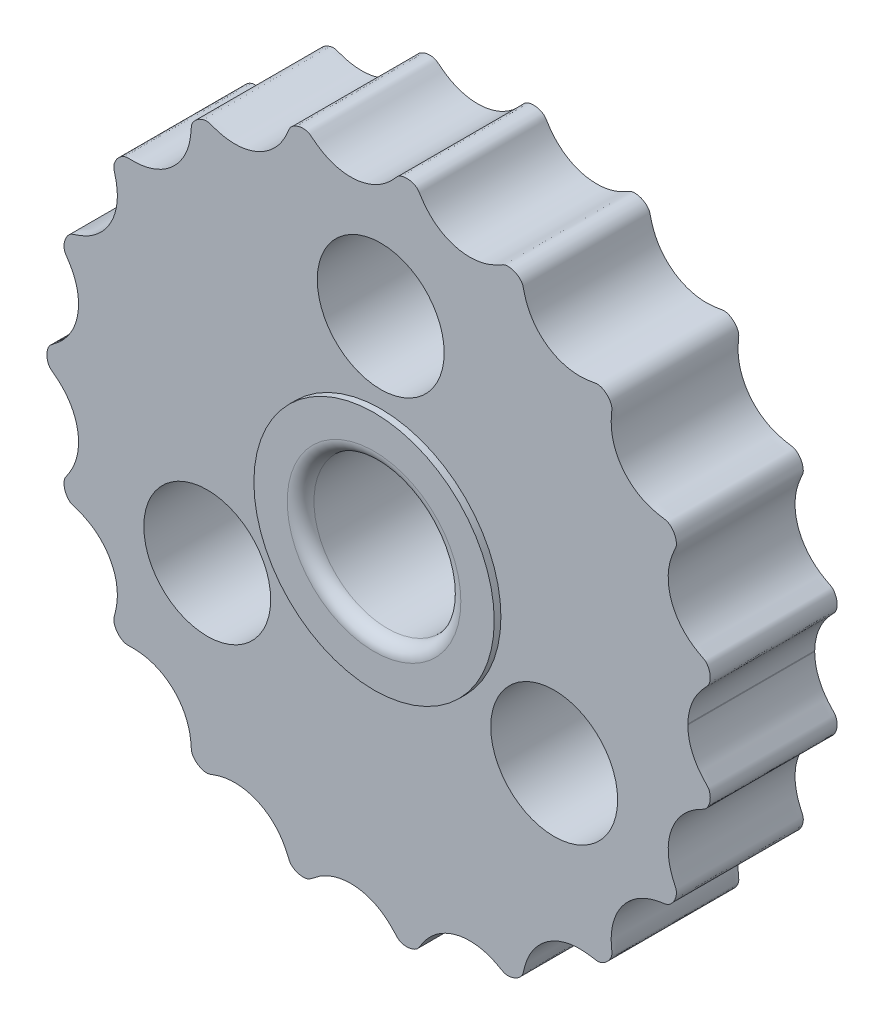
from build123d import *
from OCP.BRepAlgoAPI import BRepAlgoAPI_Cut
from OCP.TopTools import TopTools_ListOfShape

# Parameters (mm, degrees)
SKIZZE1_R                        = 25
AUFSATZ_LINEAR_AUSTRAGEN1_DEPTH  = 9.5
SCHNITT_LINEAR_AUSTRAGEN1_REACH  = 38.609
SKIZZE3_R                        = 0.5
SKIZZE9_OUTSIDE_W                = 66.268
SKIZZE9_OUTSIDE_H                = 66.263
SCHNITT_LINEAR_AUSTRAGEN6_DEPTH  = 9.5
SKIZZE23_R                       = 9
AUFSATZ_LINEAR_AUSTRAGEN2_DEPTH  = 0.5
SKIZZE21_R                       = 5.5
SCHNITT_LINEAR_AUSTRAGEN11_DEPTH = 10
VERRUNDUNG1_R                    = 1
SKIZZE22_R                       = 4.75
SCHNITT_LINEAR_AUSTRAGEN12_DEPTH = 10


with BuildPart() as part:
    # Skizze1 → Aufsatz-Linear austragen1 (new body)
    with BuildSketch(Plane.XY):
        Circle(SKIZZE1_R)
    extrude(amount=AUFSATZ_LINEAR_AUSTRAGEN1_DEPTH)

    # Skizze3 → Schnitt-Linear austragen1 (cut, up to next)
    with BuildSketch(Plane.XY.offset(9.5), mode=Mode.PRIVATE) as schnitt_linear_austragen1_sk1:
        with Locations((0, 25)):
            Circle(SKIZZE3_R)
    schnitt_linear_austragen1_tool1 = extrude(schnitt_linear_austragen1_sk1.sketch, amount=-SCHNITT_LINEAR_AUSTRAGEN1_REACH, mode=Mode.PRIVATE) & part.part
    add(schnitt_linear_austragen1_tool1.solids().sort_by_distance((0, 25, 9.5))[0], mode=Mode.SUBTRACT)


with BuildPart() as schnitt_linear_austragen6_tool:
    # Skizze9 outside → Schnitt-Linear austragen6 (new body)
    with BuildSketch(Plane.XY.offset(9.5)):
        with Locations((0, -0.0025)):
            Rectangle(SKIZZE9_OUTSIDE_W, SKIZZE9_OUTSIDE_H)
        with BuildLine():
            Line((23.000445052, 0.060937419), (23, 0))
            add(Edge.make_bspline(
                [(23, 0), (23, -0.044349008), (23.001634544, -0.133544535), (23.008990115, -0.322210424), (23.028574614, -0.495064366), (23.065190093, -0.760458288), (23.128344661, -1.048281187), (23.256601687, -1.483985708), (23.455853251, -1.931799386), (23.680914036, -2.313218321), (23.909870513, -2.622445518), (24.07431226, -2.824110253), (24.206727121, -2.972267331), (24.333633451, -3.108358174), (24.446736551, -3.225635305), (24.524022768, -3.315918282), (24.582950142, -3.415606662), (24.624575555, -3.520829648), (24.663833231, -3.668623209), (24.685212658, -3.860905388), (24.673454969, -4.086945135), (24.620520353, -4.306815249), (24.546445793, -4.484777086), (24.469451436, -4.614376883), (24.403672696, -4.702418772), (24.331050319, -4.778425537), (24.251571347, -4.839472504), (24.137679259, -4.903870311), (24.000097219, -4.973956943), (23.84602848, -5.056457749), (23.635223866, -5.176178294), (23.393295921, -5.329179221), (23.121190787, -5.527614354), (22.83161764, -5.779890288), (22.56554989, -6.056903088), (22.261697169, -6.436060568), (21.954792305, -6.933189392), (21.724897296, -7.481107687), (21.582883975, -8.065310431), (21.527316325, -8.563551076), (21.521604829, -8.970764731), (21.554125075, -9.36939933), (21.621771537, -9.756104532), (21.708688359, -10.081815143), (21.799454454, -10.348274513), (21.884205293, -10.563157843), (21.95582729, -10.729022258), (22.024783379, -10.882887471), (22.092422873, -11.024820073), (22.140398235, -11.174553681), (22.150406377, -11.346817537), (22.12742522, -11.544222174), (22.061014784, -11.76185876), (21.950504113, -11.978770955), (21.808294479, -12.167418182), (21.661405911, -12.302203337), (21.524713944, -12.391379973), (21.414032836, -12.43721046), (21.330064744, -12.458579008), (21.232109488, -12.476052218), (21.121185626, -12.492228868), (20.992061937, -12.512135255), (20.837428097, -12.539026465), (20.676348543, -12.570851463), (20.465515415, -12.619761983), (20.12052129, -12.717519847), (19.653901317, -12.897202897), (19.089906306, -13.210945732), (18.495681708, -13.693863685), (17.979768758, -14.303268377), (17.581791087, -15.018361732), (17.359944866, -15.712485613), (17.275839331, -16.272804376), (17.257885306, -16.675733613), (17.260289119, -16.912297659), (17.268312239, -17.087096877), (17.280219561, -17.249790236), (17.292103623, -17.381570247), (17.303701486, -17.494353717), (17.312264608, -17.59519884), (17.314827323, -17.684032965), (17.303731872, -17.784796247), (17.272764928, -17.89463724), (17.214331446, -18.035197831), (17.115684868, -18.199184234), (16.97055355, -18.369748736), (16.774094974, -18.530559906), (16.563256223, -18.644549245), (16.377147805, -18.704141919), (16.228010898, -18.718256331), (16.102397709, -18.706443721), (15.982650488, -18.684743591), (15.837019497, -18.658148732), (15.66401259, -18.629235343), (15.482546813, -18.604172907), (15.250492461, -18.580238466), (14.967572009, -18.565542892), (14.542882776, -18.572942029), (14.069257686, -18.636089462), (13.604258599, -18.755934349), (13.066613534, -18.966719819), (12.627823596, -19.205194372), (12.214900787, -19.503646661), (11.838876435, -19.858554155), (11.558257701, -20.183825318), (11.315746611, -20.530340865), (11.111529005, -20.892984657), (10.966201461, -21.21922683), (10.864967944, -21.499403505), (10.794070352, -21.732891274), (10.751061312, -21.893706864), (10.716991714, -22.032228461), (10.686714115, -22.158984424), (10.6596415, -22.274087772), (10.613482868, -22.409752989), (10.527338836, -22.535688011), (10.427360762, -22.644235621), (10.291112437, -22.758327008), (10.126481227, -22.862491763), (9.947040294, -22.939957105), (9.758065088, -22.988506338), (9.580990884, -23.009043361), (9.446037355, -23.007367015), (9.322218618, -22.98832781), (9.214984001, -22.94936695), (9.136712494, -22.910504045), (9.037412358, -22.855573454), (8.916331447, -22.786743456), (8.770400294, -22.708163136), (8.599394122, -22.621424072), (8.296890057, -22.482075538), (7.936423258, -22.348806181), (7.514581595, -22.240173425), (7.031331339, -22.175898472), (6.63282472, -22.160659511), (6.229783332, -22.183593355), (5.826015405, -22.24628189), (5.425311076, -22.349560047), (5.032027225, -22.494084861), (4.656518257, -22.676660873), (4.302267209, -22.894831043), (3.975506648, -23.142933834), (3.677721892, -23.416820254), (3.44405137, -23.674800098), (3.263982058, -23.904047687), (3.127014139, -24.097398487), (3.026037187, -24.249605204), (2.943370251, -24.379361317), (2.877121162, -24.486036845), (2.810740935, -24.57879713), (2.74416189, -24.652300533), (2.654279715, -24.721400662), (2.517169909, -24.800702807), (2.343070205, -24.869762739), (2.128967514, -24.917212113), (1.910391133, -24.925657676), (1.725434514, -24.904879453), (1.559739423, -24.86337266), (1.427196326, -24.812252919), (1.301753294, -24.737435115), (1.191905153, -24.625420932), (1.092920189, -24.51260355), (0.986207514, -24.3949086), (0.871449748, -24.27279856), (0.716656542, -24.117338482), (0.516618525, -23.934026062), (0.194350851, -23.67521298), (-0.281567512, -23.37339053), (-0.887269543, -23.103703015), (-1.633020944, -22.921923215), (-2.411936918, -22.880032942), (-3.183772753, -22.98328489), (-3.829023204, -23.195281934), (-4.2988972, -23.430962009), (-4.616564859, -23.630167647), (-4.823559306, -23.774552149), (-4.97774687, -23.891482046), (-5.119347714, -24.003691962), (-5.242224002, -24.103909003), (-5.336784037, -24.17043694), (-5.438268301, -24.218274505), (-5.542753751, -24.249603187), (-5.686937903, -24.275637376), (-5.871538478, -24.282233578), (-6.086374705, -24.256198966), (-6.293131419, -24.192746417), (-6.459711563, -24.112913075), (-6.600609431, -24.020448435), (-6.711181251, -23.927151216), (-6.796582984, -23.824147974), (-6.850770436, -23.71583568), (-6.898420406, -23.605777644), (-6.947365407, -23.488164192), (-7.008561783, -23.346866721), (-7.084251644, -23.183019072), (-7.185293459, -22.981995225), (-7.317773933, -22.747121988), (-7.49148797, -22.481034064), (-7.715928329, -22.192185427), (-7.968344871, -21.919017194), (-8.248406659, -21.665143187), (-8.561039816, -21.429310586), (-8.999973335, -21.15936401), (-9.485228438, -20.94396874), (-10.005750728, -20.794854161), (-10.5400902, -20.718700851), (-10.966382178, -20.701695058), (-11.385971488, -20.726307169), (-11.744136072, -20.781871828), (-12.040715619, -20.850768976), (-12.280072238, -20.919948378), (-12.464451491, -20.980432418), (-12.618960453, -21.034692841), (-12.744339362, -21.081252299), (-12.843197189, -21.112699229), (-12.914777695, -21.129342332), (-13.015493456, -21.140932804), (-13.160661859, -21.134055928), (-13.345844593, -21.094667271), (-13.56260646, -21.005188433), (-13.772683813, -20.869959052), (-13.946323804, -20.707939025), (-14.067019069, -20.543934653), (-14.143263724, -20.390738491), (-14.177226476, -20.250634214), (-14.186913508, -20.119401386), (-14.198440689, -19.946405008), (-14.213530015, -19.757442916), (-14.235675307, -19.559977047), (-14.274437993, -19.309568767), (-14.348423441, -18.950696656), (-14.498793866, -18.460238452), (-14.782089579, -17.861430032), (-15.234748365, -17.229911899), (-15.812344032, -16.679668351), (-16.491481174, -16.245685384), (-17.151171767, -15.98558094), (-17.688427228, -15.865276912), (-18.07785431, -15.818698105), (-18.344365358, -15.800803267), (-18.55154879, -15.796411929), (-18.747233389, -15.797098718), (-18.919214302, -15.801313033), (-19.042965023, -15.798032434), (-19.158541295, -15.774162573), (-19.263868768, -15.734188884), (-19.3980896, -15.664341865), (-19.552411122, -15.552423471), (-19.709792298, -15.394155651), (-19.835538635, -15.210365782), (-19.917456357, -15.039169872), (-19.969403098, -14.874816471), (-19.994190258, -14.740899926), (-19.994061908, -14.609119869), (-19.96216239, -14.459382142), (-19.920895394, -14.313172891), (-19.877538048, -14.147042514), (-19.822738803, -13.915360041), (-19.770338499, -13.638779931), (-19.729787287, -13.309541458), (-19.715499442, -12.931565797), (-19.734288413, -12.553576969), (-19.78648075, -12.177103437), (-19.872494472, -11.805088171), (-20.023495245, -11.347840311), (-20.235452427, -10.900740033), (-20.506081593, -10.477888045), (-20.831339838, -10.089797059), (-21.129561467, -9.798398433), (-21.449341767, -9.541949139), (-21.785901305, -9.320723048), (-22.090756042, -9.157591612), (-22.354079166, -9.039521408), (-22.57449546, -8.953373927), (-22.748877752, -8.891937388), (-22.912531083, -8.836937192), (-23.066356684, -8.789685219), (-23.212715882, -8.723861285), (-23.348770452, -8.613260744), (-23.480006336, -8.461017062), (-23.595931294, -8.263067795), (-23.680634411, -8.033492463), (-23.722308403, -7.802011304), (-23.721628367, -7.601527638), (-23.693635989, -7.437177019), (-23.645884227, -7.311299551), (-23.58698665, -7.21312039), (-23.50464466, -7.091898831), (-23.413480121, -6.955895234), (-23.316990468, -6.805530999), (-23.195404595, -6.600975755), (-23.068720652, -6.363313462), (-22.938312571, -6.075672915), (-22.783932861, -5.645082693), (-22.656015316, -5.100755854), (-22.599242968, -4.422068125), (-22.682573218, -3.620850866), (-22.927187084, -2.830849576), (-23.281762934, -2.183591871), (-23.6362768, -1.730779958), (-23.922117546, -1.436607135), (-24.101102734, -1.272218319), (-24.239026842, -1.154624124), (-24.371984778, -1.048237606), (-24.482308167, -0.963016223), (-24.57797062, -0.891541044), (-24.661991507, -0.827034417), (-24.732333337, -0.767244059), (-24.800898907, -0.690159367), (-24.861333187, -0.593231274), (-24.925032547, -0.457300089), (-24.978883512, -0.278375099), (-25.007975239, -0.061527264), (-24.998029137, 0.156872346), (-24.961603162, 0.339906687), (-24.906642074, 0.50012632), (-24.850441317, 0.615615614), (-24.783182463, 0.713841399), (-24.70612467, 0.790339655), (-24.641199481, 0.843342445), (-24.554870828, 0.908952697), (-24.448719227, 0.988664196), (-24.324236971, 1.08551779), (-24.183292784, 1.201125684), (-24.010485379, 1.353122041), (-23.81108179, 1.546943796), (-23.594560374, 1.787959427), (-23.371493508, 2.082915142), (-23.173407473, 2.397599431), (-23.002579424, 2.730283971), (-22.825060162, 3.168494616), (-22.696921594, 3.643219257), (-22.627743718, 4.144164769), (-22.624177416, 4.661685067), (-22.666363477, 5.09510154), (-22.751865401, 5.517351943), (-22.877747992, 5.924389933), (-23.019278499, 6.262452411), (-23.158709609, 6.535601458), (-23.284362722, 6.752410897), (-23.3882676, 6.916947859), (-23.488830891, 7.070166759), (-23.587535901, 7.210756821), (-23.671246821, 7.356766871), (-23.714168117, 7.530883328), (-23.726069468, 7.730855757), (-23.699502836, 7.95346433), (-23.630318379, 8.183104328), (-23.52633356, 8.390805115), (-23.408217078, 8.549040856), (-23.291190018, 8.662484079), (-23.187013266, 8.733895955), (-23.096821148, 8.775794948), (-22.981629081, 8.815868272), (-22.848401699, 8.858322888), (-22.69712753, 8.909663583), (-22.487141415, 8.985853442), (-22.243476665, 9.086475268), (-21.966172973, 9.220958126), (-21.659597337, 9.400507491), (-21.366019488, 9.606283221), (-21.015068462, 9.899172124), (-20.616439007, 10.319113026), (-20.277075182, 10.810519886), (-20.014381412, 11.363643533), (-19.854230856, 11.866250836), (-19.76733511, 12.278862528), (-19.722218727, 12.69227238), (-19.716907846, 13.102353212), (-19.745142047, 13.455174831), (-19.790240094, 13.74942761), (-19.839418258, 13.987801772), (-19.883928641, 14.171816656), (-19.924430221, 14.326336612), (-19.959635946, 14.452042245), (-19.981490611, 14.550865907), (-19.991146558, 14.621917303), (-19.993465617, 14.72171627), (-19.974186216, 14.864320272), (-19.919540962, 15.044506214), (-19.812527244, 15.25216623), (-19.679411984, 15.425448939), (-19.543747518, 15.55574001), (-19.401745818, 15.660735954), (-19.278658713, 15.729274103), (-19.150362589, 15.779380876), (-19.024594963, 15.798486978), (-18.926980599, 15.800538574), (-18.813257446, 15.799080978), (-18.683627696, 15.796922513), (-18.53204173, 15.796944362), (-18.31062943, 15.802325062), (-18.041284621, 15.820863743), (-17.724801817, 15.862809117), (-17.364733963, 15.94101113), (-16.917774924, 16.078626012), (-16.397352611, 16.308512891), (-15.823885698, 16.673447375), (-15.248465863, 17.213007475), (-14.783027937, 17.854203567), (-14.487819371, 18.482693114), (-14.3350991, 18.99858497), (-14.262711958, 19.375130086), (-14.226859149, 19.630575355), (-14.20749639, 19.827410906), (-14.193630668, 20.011616761), (-14.183967321, 20.173300433), (-14.169665264, 20.290528491), (-14.13620014, 20.400514429), (-14.087337219, 20.501498285), (-14.005949224, 20.629435105), (-13.880393847, 20.774171639), (-13.70771107, 20.918241132), (-13.512733191, 21.027567196), (-13.335015199, 21.093885416), (-13.164685419, 21.131095174), (-13.023217422, 21.144361796), (-12.881689292, 21.12758481), (-12.746913763, 21.081662976), (-12.631497009, 21.03976391), (-12.500061398, 20.992972587), (-12.351873906, 20.943093342), (-12.141323701, 20.87807499), (-11.86553961, 20.807502895), (-11.538863443, 20.746804727), (-11.161625373, 20.709663429), (-10.783309446, 20.705631746), (-10.303777308, 20.743163442), (-9.735365541, 20.858384867), (-9.18181952, 21.063324831), (-8.660831733, 21.356277131), (-8.259912327, 21.654194829), (-7.958145103, 21.92757187), (-7.687531539, 22.224301823), (-7.478169682, 22.501251308), (-7.318010029, 22.749249931), (-7.20056761, 22.955585939), (-7.116178939, 23.117827482), (-7.040056142, 23.277507391), (-6.979187413, 23.414280948), (-6.928975482, 23.532232778), (-6.882870247, 23.641734547), (-6.839615539, 23.742450967), (-6.773171762, 23.858311637), (-6.65282957, 23.982657264), (-6.491082256, 24.099618345), (-6.284788497, 24.198233347), (-6.048922103, 24.263470899), (-5.812488054, 24.285813995), (-5.613326656, 24.267901929), (-5.455447069, 24.226628527), (-5.347527378, 24.175192548), (-5.275554517, 24.127519588), (-5.196283273, 24.066745711), (-5.108397036, 23.995456259), (-5.005207665, 23.913288922), (-4.87956659, 23.816992501), (-4.745849829, 23.719619426), (-4.565670719, 23.597260564), (-4.257925449, 23.409520833), (-3.806481978, 23.188277614), (-3.189696877, 22.987508405), (-2.4297018, 22.881184216), (-1.632799656, 22.918771452), (-0.841139522, 23.113533128), (-0.185417958, 23.421013674), (0.279913741, 23.737791045), (0.586090336, 23.99639661), (0.75723351, 24.157626572), (0.879528328, 24.281299661), (0.990419271, 24.399613911), (1.078774774, 24.497056472), (1.153438544, 24.581504203), (1.221511196, 24.655596922), (1.284909504, 24.717121913), (1.365964253, 24.776451302), (1.466534589, 24.827405356), (1.607306031, 24.879028125), (1.791189755, 24.917323788), (2.010918157, 24.927456604), (2.228353918, 24.898176477), (2.407586515, 24.845650382), (2.563497119, 24.775949581), (2.678679926, 24.706441913), (2.777632399, 24.621649165), (2.853019608, 24.522023291), (2.908931221, 24.435321014), (2.974078542, 24.33121551), (3.051284656, 24.211060966), (3.167299359, 24.037823409), (3.331351344, 23.813630352), (3.541173762, 23.562291848), (3.803043157, 23.296719614), (4.086707511, 23.0547537), (4.391118971, 22.837513314), (4.714531329, 22.647175745), (5.143388574, 22.44428436), (5.609939139, 22.289692853), (6.103243803, 22.192847895), (6.613571115, 22.159739929), (7.039969066, 22.175523991), (7.45596771, 22.23304208), (7.857753737, 22.32901848), (8.19346564, 22.442983226), (8.465946947, 22.557985394), (8.684156853, 22.663374396), (8.851360353, 22.751583463), (9.006295735, 22.836489131), (9.148436637, 22.919582058), (9.30082606, 22.986899093), (9.45183871, 23.008270961), (9.59966399, 23.008128279), (9.776752969, 22.984634027), (9.965730297, 22.933371674), (10.144919716, 22.852814285), (10.309053586, 22.745466512), (10.44407308, 22.627824749), (10.53407695, 22.526397212), (10.603175592, 22.421236657), (10.6459465, 22.314934112), (10.669806717, 22.230421269), (10.69653886, 22.119567765), (10.728369147, 21.983278147), (10.769645086, 21.821863909), (10.822364317, 21.636487902), (10.926010427, 21.318121266), (11.074042685, 20.961211254), (11.282430556, 20.575963656), (11.565773855, 20.176091831), (11.827322448, 19.8724018), (12.119436256, 19.592389031), (12.44040703, 19.339697956), (12.876661539, 19.060768141), (13.347404564, 18.841416397), (13.841354543, 18.686544703), (14.346562303, 18.597669529), (14.697822311, 18.569296169), (14.998334673, 18.567816526), (15.242436954, 18.580630094), (15.431926482, 18.598274406), (15.616282199, 18.622023152), (15.795573094, 18.650999392), (15.962851102, 18.680431182), (16.118798238, 18.711409079), (16.263399958, 18.718550064), (16.391914742, 18.695708751), (16.543403207, 18.648374892), (16.712767044, 18.566287549), (16.893222658, 18.439957308), (17.047688615, 18.283639814), (17.157623063, 18.132363306), (17.238699297, 17.981533239), (17.290435538, 17.848540597), (17.318850043, 17.704467195), (17.309288654, 17.547054192), (17.293438171, 17.396783532), (17.279126309, 17.237718302), (17.26723479, 17.070006462), (17.258112105, 16.849933903), (17.259396139, 16.577416432), (17.288600546, 16.163150247), (17.391413432, 15.606121227), (17.607063674, 14.97582132), (17.98278944, 14.304662619), (18.482355126, 13.706633868), (19.081060914, 13.213737282), (19.671334612, 12.886965306), (20.160022126, 12.703434456), (20.519491246, 12.605928218), (20.764371272, 12.552105386), (20.953603627, 12.518237265), (21.13087845, 12.490311557), (21.286821711, 12.467902297), (21.399022085, 12.443218823), (21.502531078, 12.400834029), (21.596296463, 12.345018644), (21.713376754, 12.256098562), (21.843670156, 12.12380665), (21.970236318, 11.946885117), (22.06339444, 11.750449289), (22.117045015, 11.572589064), (22.143556613, 11.405366661), (22.148999212, 11.259824084), (22.129043967, 11.126677452), (22.084453838, 11.01317314), (22.035042439, 10.903006381), (21.981626051, 10.786711836), (21.91903893, 10.645419245), (21.84988298, 10.47817838), (21.770611386, 10.266643879), (21.68784118, 10.008603655), (21.610333735, 9.698628805), (21.550896661, 9.335505546), (21.522392058, 8.962605117), (21.527219116, 8.582673391), (21.578650743, 8.086551566), (21.697244437, 7.584617866), (21.886538483, 7.090537103), (22.145664856, 6.619857546), (22.390928041, 6.266159782), (22.666569586, 5.943750333), (22.967923595, 5.654097849), (23.25030844, 5.429986184), (23.500842393, 5.259692028), (23.712869035, 5.131359544), (23.881370584, 5.03731738), (24.02514823, 4.960864369), (24.143671879, 4.900496862), (24.233172759, 4.849199279), (24.293457338, 4.807893364), (24.370004649, 4.741544045), (24.46329889, 4.629697949), (24.559856625, 4.465993302), (24.640716486, 4.244664413), (24.682999507, 3.997236547), (24.68042987, 3.758616145), (24.640301905, 3.558001792), (24.577641328, 3.397875329), (24.495553822, 3.278627925), (24.404839843, 3.182652043), (24.285118601, 3.056518562), (24.155837943, 2.916518174), (24.025294341, 2.765947581), (23.866886198, 2.565736427), (23.65265004, 2.267267024), (23.441960579, 1.901904987), (23.254560312, 1.474212846), (23.132014183, 1.060832925), (23.07056542, 0.786083879), (23.033498116, 0.534909185), (23.013150116, 0.367843981), (23.003809227, 0.188906137), (23.00106448, 0.103341973), (23.000445052, 0.060937419)],
                knots=[0.061461869, 0.061461869, 0.061461869, 0.061461869, 0.061461869, 0.062481445, 0.063501022, 0.064520599, 0.065540176, 0.067576099, 0.069612021, 0.073551422, 0.075470515, 0.076430061, 0.077389608, 0.078784848, 0.079482469, 0.080180089, 0.080675989, 0.08117189, 0.081811292, 0.082450694, 0.08375265, 0.085055896, 0.086348118, 0.086985531, 0.087622943, 0.088090233, 0.088557523, 0.089098343, 0.089639163, 0.090720802, 0.091672036, 0.09262327, 0.094525737, 0.096489951, 0.098454164, 0.100356812, 0.10225946, 0.10627407, 0.110193456, 0.112266353, 0.11433925, 0.11636582, 0.118392389, 0.12031835, 0.122244311, 0.123154673, 0.124065035, 0.124975397, 0.125885759, 0.126557793, 0.127229826, 0.128129419, 0.129330025, 0.130553094, 0.131784273, 0.133020441, 0.134060738, 0.134556345, 0.135051953, 0.13542865, 0.135805347, 0.136558742, 0.137312136, 0.13806553, 0.138967838, 0.139870147, 0.141674763, 0.145291833, 0.149024214, 0.152819048, 0.157032102, 0.161293195, 0.165413803, 0.167416944, 0.168418515, 0.169420086, 0.17018247, 0.170944853, 0.171707237, 0.172088429, 0.172469621, 0.172982902, 0.173496183, 0.174127309, 0.174758435, 0.17604715, 0.177334859, 0.178622361, 0.179842068, 0.180858382, 0.181239448, 0.181620514, 0.182382646, 0.18330634, 0.184230034, 0.185153729, 0.186077423, 0.188008327, 0.18993923, 0.193707134, 0.195683354, 0.197659574, 0.20156597, 0.203742577, 0.205919184, 0.20806606, 0.210212936, 0.212255549, 0.214298162, 0.215256984, 0.216215807, 0.21717463, 0.217654041, 0.218133452, 0.218844998, 0.219556544, 0.220526996, 0.221172682, 0.221818368, 0.223129836, 0.224442242, 0.225090176, 0.225738109, 0.226716692, 0.227156221, 0.227595749, 0.228035278, 0.228474807, 0.229441441, 0.230408075, 0.231374709, 0.232341343, 0.236155051, 0.238142566, 0.24013008, 0.242156938, 0.244183795, 0.24626956, 0.248355325, 0.25048654, 0.252617754, 0.25467391, 0.256730066, 0.258746558, 0.260763049, 0.261683387, 0.262603725, 0.263524064, 0.264444402, 0.264788533, 0.265132665, 0.265820928, 0.266439844, 0.267058759, 0.268319629, 0.269581881, 0.270836146, 0.271447043, 0.272057939, 0.273020901, 0.273690799, 0.274360697, 0.275205248, 0.276049798, 0.276894349, 0.2777389, 0.279628283, 0.281517665, 0.285218833, 0.289070237, 0.292926287, 0.296908335, 0.300855043, 0.304679262, 0.30654518, 0.307478139, 0.308411098, 0.309767191, 0.310445237, 0.311123283, 0.311606737, 0.312090192, 0.312701594, 0.313312996, 0.314554765, 0.315800337, 0.317040482, 0.317652611, 0.31826474, 0.319193909, 0.319946353, 0.320322575, 0.320698797, 0.321608324, 0.322517851, 0.323427377, 0.324336904, 0.326144367, 0.327951831, 0.329827833, 0.331703834, 0.333633724, 0.335563614, 0.337712362, 0.342077456, 0.344293801, 0.346434782, 0.348575763, 0.35066526, 0.352754757, 0.353732581, 0.354710404, 0.355688228, 0.356666052, 0.357036209, 0.357406366, 0.357776523, 0.35814668, 0.359078007, 0.360317761, 0.361577487, 0.362842327, 0.364094692, 0.365071945, 0.365667398, 0.366262852, 0.366989275, 0.367715697, 0.369168542, 0.370082205, 0.370995868, 0.372823194, 0.376552803, 0.38039774, 0.384282664, 0.388402025, 0.39253995, 0.396544231, 0.398493694, 0.399468425, 0.400443157, 0.401928453, 0.402671102, 0.40341375, 0.403913987, 0.404414225, 0.405044338, 0.405674452, 0.406957862, 0.408242485, 0.409517363, 0.410142295, 0.410767227, 0.411714908, 0.412247239, 0.41277957, 0.413844232, 0.4147777, 0.415711168, 0.417578104, 0.419518186, 0.421458267, 0.423328359, 0.425198451, 0.427172202, 0.429145952, 0.433023392, 0.43514143, 0.437259467, 0.439338207, 0.441416947, 0.443392934, 0.445368921, 0.446300588, 0.447232254, 0.448163921, 0.449095588, 0.449784402, 0.450473216, 0.451382192, 0.452593709, 0.453825325, 0.455063918, 0.456298746, 0.45730289, 0.457852187, 0.458401483, 0.459002613, 0.459603742, 0.460806002, 0.461704818, 0.462603633, 0.464401265, 0.466233534, 0.468065804, 0.471816322, 0.475642391, 0.479892351, 0.484207442, 0.48837624, 0.490424009, 0.491447893, 0.492471777, 0.493274866, 0.494077956, 0.494881045, 0.49528259, 0.495684135, 0.496211548, 0.496738961, 0.497357205, 0.497975449, 0.499231578, 0.500491381, 0.501743384, 0.50236159, 0.502979796, 0.503901788, 0.504323365, 0.504744942, 0.505166519, 0.505588096, 0.506506968, 0.507425839, 0.50834471, 0.509263581, 0.511146457, 0.513029333, 0.514869914, 0.516710496, 0.518634982, 0.520559469, 0.524389865, 0.526592624, 0.528795383, 0.530975029, 0.533154675, 0.535263554, 0.537372432, 0.53835327, 0.539334108, 0.540314945, 0.541295783, 0.542048107, 0.542800431, 0.543686288, 0.544870456, 0.546075751, 0.547288506, 0.548504624, 0.549524184, 0.550040358, 0.550556531, 0.551041008, 0.551525485, 0.55249444, 0.553378094, 0.554261748, 0.556029056, 0.557807622, 0.559586189, 0.561417743, 0.563249298, 0.567012976, 0.571225708, 0.573386361, 0.575547015, 0.577630159, 0.579713304, 0.581758364, 0.583803424, 0.584757415, 0.585711405, 0.586665396, 0.587619386, 0.587980597, 0.588341808, 0.588703018, 0.589064229, 0.589990986, 0.591225742, 0.592481897, 0.59374487, 0.59437508, 0.595005289, 0.596034993, 0.596580579, 0.597126165, 0.597562516, 0.597998867, 0.598871569, 0.599744271, 0.600616973, 0.602464647, 0.60431232, 0.606174746, 0.608037171, 0.611882783, 0.615747661, 0.619804001, 0.623847233, 0.627760176, 0.629667042, 0.630620475, 0.631573908, 0.632960263, 0.63365344, 0.634346617, 0.634839622, 0.635332626, 0.635965359, 0.636598093, 0.63788999, 0.639180695, 0.640471372, 0.641083557, 0.641695743, 0.642695231, 0.643314822, 0.643934412, 0.644554003, 0.645173594, 0.646129545, 0.647085497, 0.648997399, 0.650909523, 0.652821646, 0.654718686, 0.656615725, 0.660595184, 0.664475995, 0.66655082, 0.668625645, 0.670649627, 0.672673608, 0.674635575, 0.675616559, 0.676597542, 0.677459594, 0.678321645, 0.679183697, 0.679614722, 0.680045748, 0.680717948, 0.681390147, 0.682294064, 0.683500503, 0.684729773, 0.685967267, 0.687210114, 0.68825602, 0.68874479, 0.68923356, 0.689613898, 0.689994235, 0.690754909, 0.691515583, 0.692276257, 0.69318362, 0.694090983, 0.695905709, 0.699541039, 0.703294389, 0.707104333, 0.711296015, 0.715529056, 0.719622991, 0.721613785, 0.722609182, 0.723604579, 0.724362502, 0.725120424, 0.725878347, 0.726257308, 0.726636269, 0.727146511, 0.727656752, 0.728277518, 0.728898283, 0.730163027, 0.731428819, 0.732686728, 0.733300114, 0.733913501, 0.734868188, 0.73538728, 0.735906371, 0.736425463, 0.736944554, 0.73786553, 0.738786506, 0.740628457, 0.742543985, 0.744459512, 0.746297797, 0.748136082, 0.750075712, 0.752015342, 0.755850354, 0.758013558, 0.760176761, 0.762308008, 0.764439255, 0.766466447, 0.768493639, 0.769446296, 0.770398953, 0.771351609, 0.772304266, 0.773010518, 0.77371677, 0.774692014, 0.775340978, 0.775989942, 0.777308168, 0.778627356, 0.779278498, 0.779929639, 0.7809117, 0.781353356, 0.781795012, 0.782236668, 0.782678324, 0.783649926, 0.784621528, 0.785593129, 0.786564731, 0.79039886, 0.792397566, 0.794396271, 0.796431969, 0.798467667, 0.800543572, 0.802619477, 0.806855275, 0.808898188, 0.810941102, 0.812947147, 0.813950169, 0.814953191, 0.815868189, 0.816783186, 0.817698184, 0.818613182, 0.819297292, 0.819981402, 0.820603238, 0.821225074, 0.822491763, 0.823759871, 0.825019489, 0.825633476, 0.826247462, 0.827207841, 0.827885659, 0.828563477, 0.829410873, 0.830258269, 0.831105665, 0.83195306, 0.833851593, 0.835750126, 0.839469591, 0.84334196, 0.847211812, 0.851171733, 0.855089792, 0.858887816, 0.860741655, 0.861668574, 0.862595494, 0.863942523, 0.864616038, 0.865289552, 0.865770228, 0.866250904, 0.866865514, 0.867480124, 0.868728307, 0.869980404, 0.871226481, 0.871842593, 0.872458706, 0.873390393, 0.874149913, 0.874529673, 0.874909433, 0.875821436, 0.876733439, 0.877645443, 0.878557446, 0.880375808, 0.88219417, 0.884080941, 0.885967711, 0.887906445, 0.889845178, 0.894123322, 0.896327099, 0.898530875, 0.900658637, 0.902786399, 0.904865784, 0.90694517, 0.907917553, 0.908889936, 0.909862318, 0.910834701, 0.911202796, 0.911570891, 0.911938986, 0.912307081, 0.913242964, 0.914488698, 0.9157545, 0.91702529, 0.918282922, 0.919265523, 0.919863292, 0.920461062, 0.921190028, 0.921918995, 0.923376927, 0.924296159, 0.92521539, 0.927053853, 0.930802192, 0.932735308, 0.934668424, 0.935643402, 0.93661838, 0.937593358, 0.938568336, 0.938568336, 0.938568336, 0.938568336, 0.938568336], degree=4))
        make_face(mode=Mode.SUBTRACT)
    extrude(amount=-SCHNITT_LINEAR_AUSTRAGEN6_DEPTH)


with BuildPart() as part_1:
    add(part.part)

    # Schnitt-Linear austragen6: cut by schnitt_linear_austragen6_tool, with a tolerance
    schnitt_linear_austragen6_stock = TopTools_ListOfShape()
    schnitt_linear_austragen6_stock.Append(part_1.part.wrapped)
    schnitt_linear_austragen6_tools = TopTools_ListOfShape()
    schnitt_linear_austragen6_tools.Append(schnitt_linear_austragen6_tool.part.wrapped)
    schnitt_linear_austragen6_cut = BRepAlgoAPI_Cut()
    schnitt_linear_austragen6_cut.SetArguments(schnitt_linear_austragen6_stock)
    schnitt_linear_austragen6_cut.SetTools(schnitt_linear_austragen6_tools)
    schnitt_linear_austragen6_cut.SetFuzzyValue(0.00001)
    schnitt_linear_austragen6_cut.Build()
    add(Compound.cast(schnitt_linear_austragen6_cut.Shape()).solids(), mode=Mode.REPLACE)

    # Skizze23 → Aufsatz-Linear austragen2 (add)
    with BuildSketch(Plane.XY.offset(9.5)):
        Circle(SKIZZE23_R)
    extrude(amount=AUFSATZ_LINEAR_AUSTRAGEN2_DEPTH)

    # Skizze21 → Schnitt-Linear austragen11 (cut)
    with BuildSketch(Plane(origin=(0, 0, 0), x_dir=(-1, 0, 0), z_dir=(0, 0, -1))):
        Circle(SKIZZE21_R)
    extrude(amount=-SCHNITT_LINEAR_AUSTRAGEN11_DEPTH, mode=Mode.SUBTRACT)

    # Verrundung1
    verrundung1_edges = [part_1.edges().sort_by_distance(p)[0] for p in [
        (5.5, 0, 0),
        (5.5, 0, 10),
    ]]
    fillet(verrundung1_edges, radius=VERRUNDUNG1_R)

    # Skizze22 → Schnitt-Linear austragen12 (cut)
    with BuildSketch(Plane(origin=(0, 0, 0), x_dir=(-1, 0, 0), z_dir=(0, 0, -1))):
        with Locations((0, 15)):
            Circle(SKIZZE22_R)
        with Locations((12.990381057, -7.5)):
            Circle(SKIZZE22_R)
        with Locations((-12.990381057, -7.5)):
            Circle(SKIZZE22_R)
    extrude(amount=-SCHNITT_LINEAR_AUSTRAGEN12_DEPTH, mode=Mode.SUBTRACT)


solid = part_1.part
